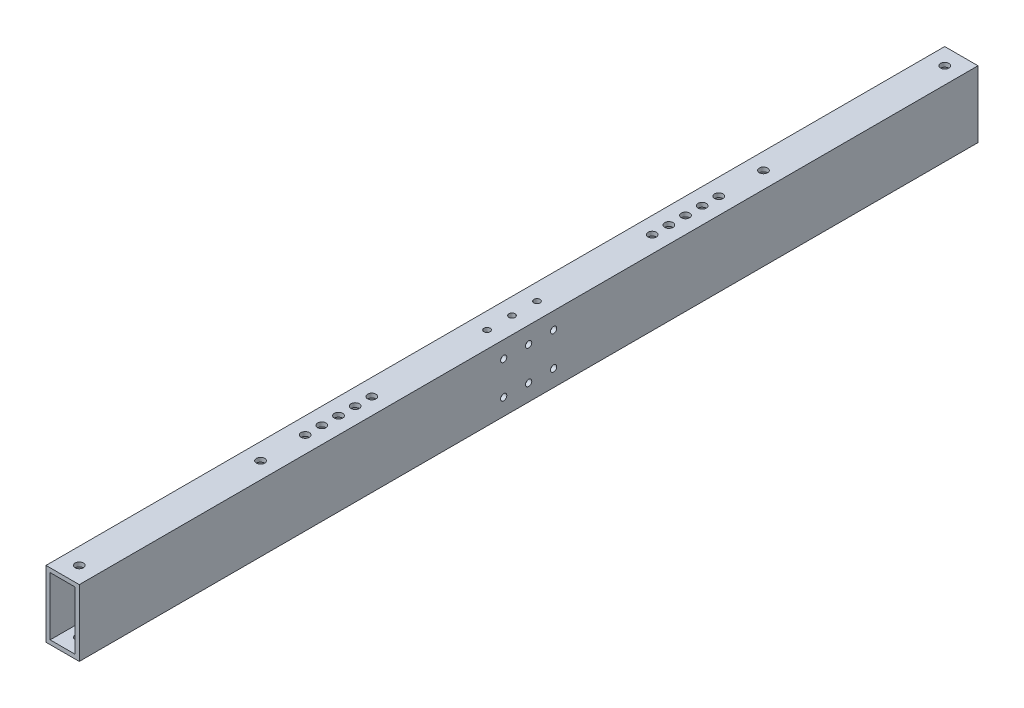
from build123d import *

# Parameters (mm, degrees)
SKETCH1_W           = 25.4
SKETCH1_H           = 50.8
SKETCH1_W_2         = 19.05
SKETCH1_H_2         = 44.45
BOSS_EXTRUDE1_DEPTH = 685.8
SKETCH2_R           = 3.175
CUT_EXTRUDE1_DEPTH  = 688.796168934
SKETCH3_R           = 2.38125
CUT_EXTRUDE2_DEPTH  = 3.175
SKETCH4_R           = 2.38125
CUT_EXTRUDE3_DEPTH  = 688.796168934


with BuildPart() as part:
    # Sketch1 → Boss-Extrude1 (new body)
    with BuildSketch(Plane.XY):
        Rectangle(SKETCH1_W, SKETCH1_H)
        Rectangle(SKETCH1_W_2, SKETCH1_H_2, mode=Mode.SUBTRACT)
    extrude(amount=BOSS_EXTRUDE1_DEPTH)

    # Sketch2 → Cut-Extrude1 (cut, through all)
    with BuildSketch(Plane(origin=(0, 25.4, 0), x_dir=(1, 0, 0), z_dir=(0, 1, 0))):
        with Locations((0, -12.7)):
            Circle(SKETCH2_R)
        with Locations((0, -151.012144)):
            Circle(SKETCH2_R)
        with Locations((0, -534.787856)):
            Circle(SKETCH2_R)
        with Locations((0, -673.1)):
            Circle(SKETCH2_R)
        with Locations((0, -185.1062846)):
            Circle(SKETCH2_R)
        with Locations((0, -197.8062846)):
            Circle(SKETCH2_R)
        with Locations((0, -210.5062846)):
            Circle(SKETCH2_R)
        with Locations((0, -223.2062846)):
            Circle(SKETCH2_R)
        with Locations((0, -235.9062846)):
            Circle(SKETCH2_R)
        with Locations((0, -449.8937154)):
            Circle(SKETCH2_R)
        with Locations((0, -462.5937154)):
            Circle(SKETCH2_R)
        with Locations((0, -475.2937154)):
            Circle(SKETCH2_R)
        with Locations((0, -487.9937154)):
            Circle(SKETCH2_R)
        with Locations((0, -500.6937154)):
            Circle(SKETCH2_R)
    extrude(amount=-CUT_EXTRUDE1_DEPTH, mode=Mode.SUBTRACT)

    # Sketch3 → Cut-Extrude2 (cut)
    with BuildSketch(Plane(origin=(12.7, 0, 0), x_dir=(0, 0, -1), z_dir=(1, 0, 0))):
        with Locations((-361.95, -12.7)):
            Circle(SKETCH3_R)
        with Locations((-342.9, -12.7)):
            Circle(SKETCH3_R)
        with Locations((-323.85, -12.7)):
            Circle(SKETCH3_R)
        with Locations((-323.85, 12.7)):
            Circle(SKETCH3_R)
        with Locations((-361.95, 12.7)):
            Circle(SKETCH3_R)
        with Locations((-342.9, 12.7)):
            Circle(SKETCH3_R)
    extrude(amount=-CUT_EXTRUDE2_DEPTH, mode=Mode.SUBTRACT)

    # Sketch4 → Cut-Extrude3 (cut, through all)
    with BuildSketch(Plane(origin=(0, -25.4, 0), x_dir=(-1, 0, 0), z_dir=(0, -1, 0))):
        with Locations((0, -342.9)):
            Circle(SKETCH4_R)
        with Locations((0, -361.95)):
            Circle(SKETCH4_R)
        with Locations((0, -323.85)):
            Circle(SKETCH4_R)
    extrude(amount=-CUT_EXTRUDE3_DEPTH, mode=Mode.SUBTRACT)


solid = part.part
